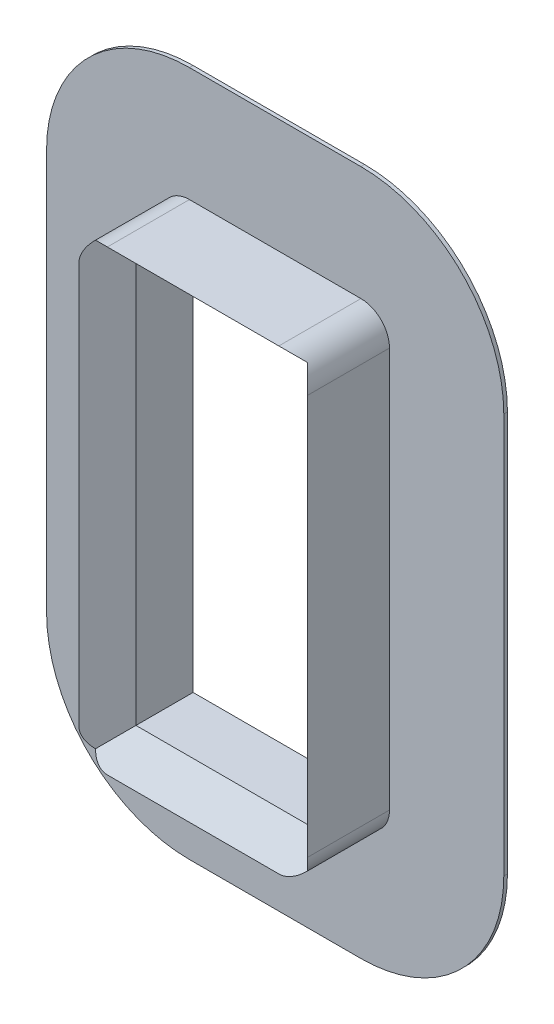
from build123d import *

# Parameters (mm, degrees)
BOSS_EXTRUDE1_DEPTH = 0.4064
SKETCH3_W           = 19.05
SKETCH3_H           = 44.45
BOSS_EXTRUDE5_DEPTH = 9.525


with BuildPart() as part:
    # Sketch2 → Boss-Extrude1 (new body)
    with BuildSketch(Plane.XY):
        with BuildLine():
            Line((-9.525, 158.75), (9.525, 158.75))
            ThreePointArc((9.525, 158.75), (20.750320151, 154.100320151), (25.4, 142.875))
            Line((25.4, 142.875), (25.4, 98.425))
            ThreePointArc((25.4, 98.425), (20.750320151, 87.199679849), (9.525, 82.55))
            Line((9.525, 82.55), (-9.525, 82.55))
            ThreePointArc((-9.525, 82.55), (-20.750320151, 87.199679849), (-25.4, 98.425))
            Line((-25.4, 98.425), (-25.4, 142.875))
            ThreePointArc((-25.4, 142.875), (-20.750320151, 154.100320151), (-9.525, 158.75))
        make_face()
        with BuildLine():
            Line((-9.525, 95.25), (9.525, 95.25))
            ThreePointArc((9.525, 95.25), (11.77006403, 96.17993597), (12.7, 98.425))
            Line((12.7, 98.425), (12.7, 142.875))
            ThreePointArc((12.7, 142.875), (11.77006403, 145.12006403), (9.525, 146.05))
            Line((9.525, 146.05), (-9.525, 146.05))
            ThreePointArc((-9.525, 146.05), (-11.77006403, 145.12006403), (-12.7, 142.875))
            Line((-12.7, 142.875), (-12.7, 98.425))
            ThreePointArc((-12.7, 98.425), (-11.77006403, 96.17993597), (-9.525, 95.25))
        make_face(mode=Mode.SUBTRACT)
    extrude(amount=BOSS_EXTRUDE1_DEPTH)


with BuildPart() as body_2:
    # Sketch3 → Boss-Extrude5 (new body)
    with BuildSketch(Plane.XY):
        with BuildLine():
            Line((-9.525, 95.25), (9.525, 95.25))
            ThreePointArc((9.525, 95.25), (11.77006403, 96.17993597), (12.7, 98.425))
            Line((12.7, 98.425), (12.7, 142.875))
            ThreePointArc((12.7, 142.875), (11.77006403, 145.12006403), (9.525, 146.05))
            Line((9.525, 146.05), (-9.525, 146.05))
            ThreePointArc((-9.525, 146.05), (-11.77006403, 145.12006403), (-12.7, 142.875))
            Line((-12.7, 142.875), (-12.7, 98.425))
            ThreePointArc((-12.7, 98.425), (-11.77006403, 96.17993597), (-9.525, 95.25))
        make_face()
        with Locations((0, 120.65)):
            Rectangle(SKETCH3_W, SKETCH3_H, mode=Mode.SUBTRACT)
    extrude(amount=BOSS_EXTRUDE5_DEPTH)

    # Chamfer2
    # the kernel refuses this chamfer: 3.175 mm, written as the material it takes off along each edge
    with BuildSketch(Plane(origin=(9.525, 142.875, 9.525), x_dir=(0, -0.02749587661058566, -0.9996219169112968), z_dir=(-1, 0, 0)), Plane(origin=(-9.525, 98.425, 9.525), x_dir=(0, 0.027495876610585654, -0.9996219169112968), z_dir=(1, 0, 0))) as chamfer2_piece_1:
        with BuildLine():
            Line((3.266037395, 0), (-0.179537217, -3.261098994))
            Line((-0.179537217, -3.261098994), (-0.243013208, -3.259353006))
            ThreePointArc((-0.243013208, -3.259353006), (-0.108360296, -1.630038109), (-0.063475992, 0.001745988))
            Line((-0.063475992, 0.001745988), (0.001745988, 0.063475992))
            ThreePointArc((0.001745988, 0.063475992), (1.633530085, 0.018591688), (3.267783383, 0.063475992))
            Line((3.267783383, 0.063475992), (3.266037395, 0))
        make_face()
    extrude(amount=19.05, mode=Mode.SUBTRACT)
    with BuildSketch(Plane(origin=(9.525, 98.425, 9.525), x_dir=(-0.027495876610586195, 0, -0.9996219169112966), z_dir=(0, 1, 0)), Plane(origin=(-9.525, 142.875, 9.525), x_dir=(0.027495876610586195, 0, -0.9996219169112966), z_dir=(0, -1, 0))) as chamfer2_piece_2:
        with BuildLine():
            Line((3.266037395, 0), (-0.179537217, -3.261098994))
            Line((-0.179537217, -3.261098994), (-0.243013208, -3.259353006))
            ThreePointArc((-0.243013208, -3.259353006), (-0.108360296, -1.630038109), (-0.063475992, 0.001745988))
            Line((-0.063475992, 0.001745988), (0.001745988, 0.063475992))
            ThreePointArc((0.001745988, 0.063475992), (1.633530085, 0.018591688), (3.267783383, 0.063475992))
            Line((3.267783383, 0.063475992), (3.266037395, 0))
        make_face()
    extrude(amount=44.45, mode=Mode.SUBTRACT)
    with BuildSketch(Plane(origin=(17.690093487, 142.875, 9.525), x_dir=(0, -0.02749587661058566, -0.9996219169112968), z_dir=(-1, 0, 0))) as chamfer2_piece_3a_section:
        with BuildLine():
            Line((3.266037395, 0), (-0.179537217, -3.261098994))
            Line((-0.179537217, -3.261098994), (-0.243013208, -3.259353006))
            ThreePointArc((-0.243013208, -3.259353006), (-0.108360296, -1.630038109), (-0.063475992, 0.001745988))
            Line((-0.063475992, 0.001745988), (0.001745988, 0.063475992))
            ThreePointArc((0.001745988, 0.063475992), (1.633530085, 0.018591688), (3.267783383, 0.063475992))
            Line((3.267783383, 0.063475992), (3.266037395, 0))
        make_face()
    chamfer2_piece_3a = extrude(amount=27.215093487, mode=Mode.PRIVATE)
    chamfer2_piece_3a = split(chamfer2_piece_3a, bisect_by=Plane(origin=(9.525, 143.922094765, 8.477905235), z_dir=(1, 0, 0)), keep=Keep.TOP, mode=Mode.PRIVATE)
    with BuildSketch(Plane(origin=(9.525, 98.425, 9.525), x_dir=(-0.027495876610586195, 0, -0.9996219169112966), z_dir=(0, 1, 0))) as chamfer2_piece_3b_section:
        with BuildLine():
            Line((3.266037395, 0), (-0.179537217, -3.261098994))
            Line((-0.179537217, -3.261098994), (-0.243013208, -3.259353006))
            ThreePointArc((-0.243013208, -3.259353006), (-0.108360296, -1.630038109), (-0.063475992, 0.001745988))
            Line((-0.063475992, 0.001745988), (0.001745988, 0.063475992))
            ThreePointArc((0.001745988, 0.063475992), (1.633530085, 0.018591688), (3.267783383, 0.063475992))
            Line((3.267783383, 0.063475992), (3.266037395, 0))
        make_face()
    chamfer2_piece_3b = extrude(amount=52.615093487, mode=Mode.PRIVATE)
    chamfer2_piece_3b = split(chamfer2_piece_3b, bisect_by=Plane(origin=(10.572094765, 142.875, 8.477905235), z_dir=(0, 1, 0)), keep=Keep.TOP, mode=Mode.PRIVATE)
    chamfer2_piece_3 = chamfer2_piece_3a & chamfer2_piece_3b
    add(chamfer2_piece_3, mode=Mode.SUBTRACT)
    with BuildSketch(Plane(origin=(9.525, 142.875, 9.525), x_dir=(0, -0.02749587661058566, -0.9996219169112968), z_dir=(-1, 0, 0))) as chamfer2_piece_4a_section:
        with BuildLine():
            Line((3.266037395, 0), (-0.179537217, -3.261098994))
            Line((-0.179537217, -3.261098994), (-0.243013208, -3.259353006))
            ThreePointArc((-0.243013208, -3.259353006), (-0.108360296, -1.630038109), (-0.063475992, 0.001745988))
            Line((-0.063475992, 0.001745988), (0.001745988, 0.063475992))
            ThreePointArc((0.001745988, 0.063475992), (1.633530085, 0.018591688), (3.267783383, 0.063475992))
            Line((3.267783383, 0.063475992), (3.266037395, 0))
        make_face()
    chamfer2_piece_4a = extrude(amount=27.215093487, mode=Mode.PRIVATE)
    chamfer2_piece_4a = split(chamfer2_piece_4a, bisect_by=Plane(origin=(-9.525, 143.922094765, 8.477905235), z_dir=(-1, 0, 0)), keep=Keep.TOP, mode=Mode.PRIVATE)
    with BuildSketch(Plane(origin=(-9.525, 151.040093487, 9.525), x_dir=(0.027495876610586195, 0, -0.9996219169112966), z_dir=(0, -1, 0))) as chamfer2_piece_4b_section:
        with BuildLine():
            Line((3.266037395, 0), (-0.179537217, -3.261098994))
            Line((-0.179537217, -3.261098994), (-0.243013208, -3.259353006))
            ThreePointArc((-0.243013208, -3.259353006), (-0.108360296, -1.630038109), (-0.063475992, 0.001745988))
            Line((-0.063475992, 0.001745988), (0.001745988, 0.063475992))
            ThreePointArc((0.001745988, 0.063475992), (1.633530085, 0.018591688), (3.267783383, 0.063475992))
            Line((3.267783383, 0.063475992), (3.266037395, 0))
        make_face()
    chamfer2_piece_4b = extrude(amount=52.615093487, mode=Mode.PRIVATE)
    chamfer2_piece_4b = split(chamfer2_piece_4b, bisect_by=Plane(origin=(-10.572094765, 142.875, 8.477905235), z_dir=(0, 1, 0)), keep=Keep.TOP, mode=Mode.PRIVATE)
    chamfer2_piece_4 = chamfer2_piece_4a & chamfer2_piece_4b
    add(chamfer2_piece_4, mode=Mode.SUBTRACT)
    with BuildSketch(Plane(origin=(9.525, 90.259906513, 9.525), x_dir=(-0.027495876610586195, 0, -0.9996219169112966), z_dir=(0, 1, 0))) as chamfer2_piece_5a_section:
        with BuildLine():
            Line((3.266037395, 0), (-0.179537217, -3.261098994))
            Line((-0.179537217, -3.261098994), (-0.243013208, -3.259353006))
            ThreePointArc((-0.243013208, -3.259353006), (-0.108360296, -1.630038109), (-0.063475992, 0.001745988))
            Line((-0.063475992, 0.001745988), (0.001745988, 0.063475992))
            ThreePointArc((0.001745988, 0.063475992), (1.633530085, 0.018591688), (3.267783383, 0.063475992))
            Line((3.267783383, 0.063475992), (3.266037395, 0))
        make_face()
    chamfer2_piece_5a = extrude(amount=52.615093487, mode=Mode.PRIVATE)
    chamfer2_piece_5a = split(chamfer2_piece_5a, bisect_by=Plane(origin=(10.572094765, 98.425, 8.477905235), z_dir=(0, -1, 0)), keep=Keep.TOP, mode=Mode.PRIVATE)
    with BuildSketch(Plane(origin=(-9.525, 98.425, 9.525), x_dir=(0, 0.027495876610585654, -0.9996219169112968), z_dir=(1, 0, 0))) as chamfer2_piece_5b_section:
        with BuildLine():
            Line((3.266037395, 0), (-0.179537217, -3.261098994))
            Line((-0.179537217, -3.261098994), (-0.243013208, -3.259353006))
            ThreePointArc((-0.243013208, -3.259353006), (-0.108360296, -1.630038109), (-0.063475992, 0.001745988))
            Line((-0.063475992, 0.001745988), (0.001745988, 0.063475992))
            ThreePointArc((0.001745988, 0.063475992), (1.633530085, 0.018591688), (3.267783383, 0.063475992))
            Line((3.267783383, 0.063475992), (3.266037395, 0))
        make_face()
    chamfer2_piece_5b = extrude(amount=27.215093487, mode=Mode.PRIVATE)
    chamfer2_piece_5b = split(chamfer2_piece_5b, bisect_by=Plane(origin=(9.525, 97.377905235, 8.477905235), z_dir=(1, 0, 0)), keep=Keep.TOP, mode=Mode.PRIVATE)
    chamfer2_piece_5 = chamfer2_piece_5a & chamfer2_piece_5b
    add(chamfer2_piece_5, mode=Mode.SUBTRACT)
    with BuildSketch(Plane(origin=(-17.690093487, 98.425, 9.525), x_dir=(0, 0.027495876610585654, -0.9996219169112968), z_dir=(1, 0, 0))) as chamfer2_piece_6a_section:
        with BuildLine():
            Line((3.266037395, 0), (-0.179537217, -3.261098994))
            Line((-0.179537217, -3.261098994), (-0.243013208, -3.259353006))
            ThreePointArc((-0.243013208, -3.259353006), (-0.108360296, -1.630038109), (-0.063475992, 0.001745988))
            Line((-0.063475992, 0.001745988), (0.001745988, 0.063475992))
            ThreePointArc((0.001745988, 0.063475992), (1.633530085, 0.018591688), (3.267783383, 0.063475992))
            Line((3.267783383, 0.063475992), (3.266037395, 0))
        make_face()
    chamfer2_piece_6a = extrude(amount=27.215093487, mode=Mode.PRIVATE)
    chamfer2_piece_6a = split(chamfer2_piece_6a, bisect_by=Plane(origin=(-9.525, 97.377905235, 8.477905235), z_dir=(-1, 0, 0)), keep=Keep.TOP, mode=Mode.PRIVATE)
    with BuildSketch(Plane(origin=(-9.525, 142.875, 9.525), x_dir=(0.027495876610586195, 0, -0.9996219169112966), z_dir=(0, -1, 0))) as chamfer2_piece_6b_section:
        with BuildLine():
            Line((3.266037395, 0), (-0.179537217, -3.261098994))
            Line((-0.179537217, -3.261098994), (-0.243013208, -3.259353006))
            ThreePointArc((-0.243013208, -3.259353006), (-0.108360296, -1.630038109), (-0.063475992, 0.001745988))
            Line((-0.063475992, 0.001745988), (0.001745988, 0.063475992))
            ThreePointArc((0.001745988, 0.063475992), (1.633530085, 0.018591688), (3.267783383, 0.063475992))
            Line((3.267783383, 0.063475992), (3.266037395, 0))
        make_face()
    chamfer2_piece_6b = extrude(amount=52.615093487, mode=Mode.PRIVATE)
    chamfer2_piece_6b = split(chamfer2_piece_6b, bisect_by=Plane(origin=(-10.572094765, 98.425, 8.477905235), z_dir=(0, -1, 0)), keep=Keep.TOP, mode=Mode.PRIVATE)
    chamfer2_piece_6 = chamfer2_piece_6a & chamfer2_piece_6b
    add(chamfer2_piece_6, mode=Mode.SUBTRACT)


solid = Compound([part.part, body_2.part])
